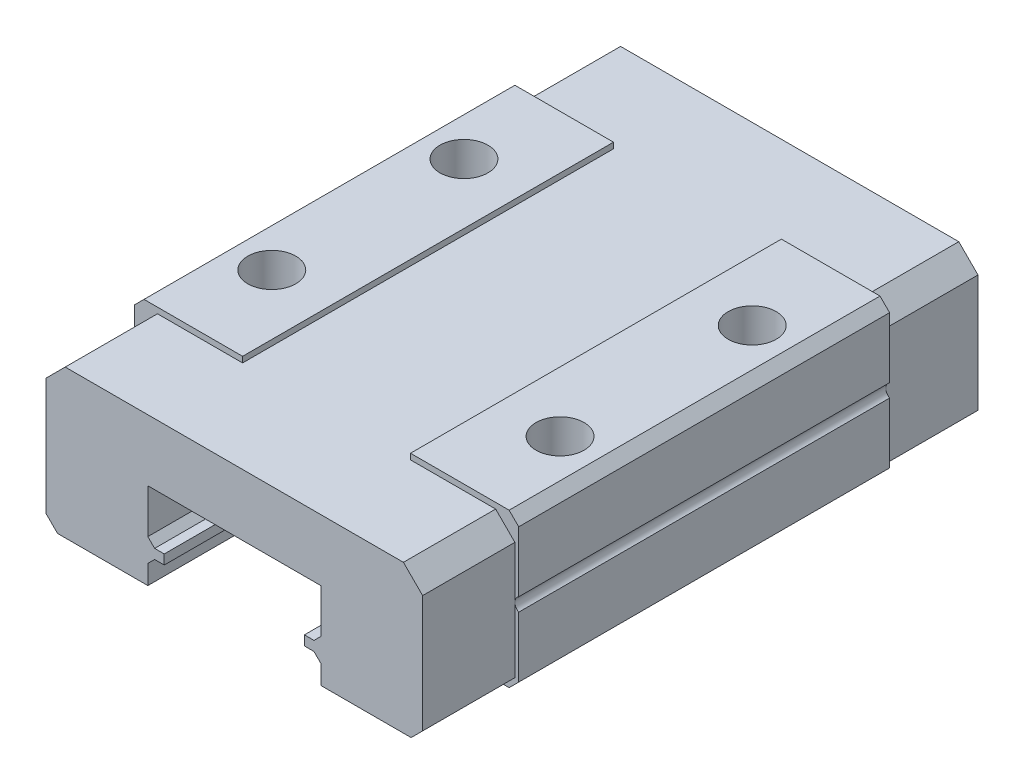
from build123d import *

# Parameters (mm, degrees)
EXTRUDE_1_DEPTH     = 28.9
CHAMFER_1_SIZE      = 0.5
CUT_EXTRUDE_1_DEPTH = 0.3
SKETCH_6_W          = 0.2
SKETCH_6_H          = 4.8
CUT_EXTRUDE_2_DEPTH = 8.3
CHAMFER_2_SIZE      = 1
CHAMFER_3_SIZE      = 0.6
CHAMFER_4_SIZE      = 0.5
SKETCH_7_R          = 0.4
CUT_EXTRUDE_3_DEPTH = 19.3


with BuildPart() as part:
    # 草图1 → 凸台-拉伸1 (new body)
    with BuildSketch(Plane.XY):
        Polygon((-10, 0), (-10, 8), (10, 8), (10, 0), (4.5, 0), (4.5, 1), (4.146446609, 1.353553391), (3.646446609, 1.353553391), (3.646446609, 1.853553391), (4.146446609, 1.853553391), (4.5, 2.207106781), (4.5, 4.5), (-4.5, 4.5), (-4.5, 2.207106781), (-4.146446609, 1.853553391), (-3.646446609, 1.853553391), (-3.646446609, 1.353553391), (-4.146446609, 1.353553391), (-4.5, 1), (-4.5, 0), align=None)
    extrude(amount=-EXTRUDE_1_DEPTH)

    # 草图3 → M3 螺纹孔1 (revolve, cut)
    with BuildSketch(Plane(origin=(7.5, 8, -19.45), x_dir=(0, 0, 1), z_dir=(1, 0, 0))):
        Polygon((0, 0), (0, 3.751075774), (1.25, 3), (1.25, 0), align=None)
    hole_wizard_m3_1 = revolve(axis=Axis((7.5, 14.35, -19.45), (0, -1, 0)), mode=Mode.SUBTRACT)

    # 镜向1: M3 螺纹孔1 across plane
    add(hole_wizard_m3_1.mirror(Plane(origin=(0, 0, -14.45), x_dir=(1, 0, 0), z_dir=(0, 0, -1))), mode=Mode.SUBTRACT)

    # 镜向2: M3 螺纹孔1 across plane
    add(hole_wizard_m3_1.mirror(Plane.ZY), mode=Mode.SUBTRACT)

    # 镜向2 copy 1 sketch → 镜向2 copy 1 (revolve, cut)
    with BuildSketch(Plane(origin=(-7.5, 8, -9.45), x_dir=(0, 0, -1), z_dir=(-1, 0, 0))):
        Polygon((0, 0), (0, 3.751075774), (1.25, 3), (1.25, 0), align=None)
    revolve(axis=Axis((-7.5, 14.35, -9.45), (0, -1, 0)), mode=Mode.SUBTRACT)

    # 倒角1
    chamfer_1_edges = [part.edges().sort_by_distance(p)[0] for p in [
        (10, 8, -14.45),
        (-10, 8, -14.45),
    ]]
    chamfer(chamfer_1_edges, length=CHAMFER_1_SIZE)

    # 草图5 → 切除-拉伸1 (cut)
    with BuildSketch(Plane(origin=(0, 8, 0), x_dir=(1, 0, 0), z_dir=(0, 1, 0))):
        Polygon((-9.5, 24.1), (-4.368581018, 24.1), (-4.368581018, 4.8), (-9.5, 4.8), (-10, 4.8), (-10, 0), (10, 0), (10, 4.8), (9.5, 4.8), (4.368581018, 4.8), (4.368581018, 24.1), (9.5, 24.1), (10, 24.1), (10, 28.9), (-10, 28.9), (-10, 24.1), align=None)
    extrude(amount=-CUT_EXTRUDE_1_DEPTH, mode=Mode.SUBTRACT)

    # 草图6 → 切除-拉伸2 (cut)
    with BuildSketch(Plane(origin=(0, 7.7, 0), x_dir=(1, 0, 0), z_dir=(0, 1, 0))):
        with Locations((-9.9, 26.5)):
            Rectangle(SKETCH_6_W, SKETCH_6_H)
        with Locations((9.9, 26.5)):
            Rectangle(SKETCH_6_W, SKETCH_6_H)
        with Locations((9.9, 2.4)):
            Rectangle(SKETCH_6_W, SKETCH_6_H)
        with Locations((-9.9, 2.4)):
            Rectangle(SKETCH_6_W, SKETCH_6_H)
    extrude(amount=-CUT_EXTRUDE_2_DEPTH, mode=Mode.SUBTRACT)

    # 倒角2
    # the kernel refuses this chamfer: 1 mm, written as the material it takes off along each edge
    with BuildSketch(Plane(origin=(-9.8, 7.7, -4.8), x_dir=(-0.027495876610583895, -0.9996219169112968, 0), z_dir=(0, 0, 1)), Plane(origin=(-9.8, 7.7, -31.471682988), x_dir=(-0.027495876610585623, -0.9996219169112968, 0), z_dir=(0, 0, 1))) as chamfer_2_piece_1:
        Polygon((CHAMFER_2_SIZE * 0.999621916911, CHAMFER_2_SIZE * 0.0274958766106), (-CHAMFER_2_SIZE * 0.0274958766106, CHAMFER_2_SIZE * 0.999621916911), (0, 0), align=None)
    extrude(amount=7.371682988, mode=Mode.SUBTRACT)
    with BuildSketch(Plane(origin=(9.8, 7.7, 2.571682988), x_dir=(-0.9996219169112968, 0.02749587661058651, 0), z_dir=(0, 0, -1)), Plane(origin=(9.8, 7.7, -24.1), x_dir=(-0.9996219169112968, 0.02749587661058651, 0), z_dir=(0, 0, -1))) as chamfer_2_piece_2:
        Polygon((CHAMFER_2_SIZE * 0.999621916911, -CHAMFER_2_SIZE * 0.0274958766106), (-CHAMFER_2_SIZE * 0.0274958766106, -CHAMFER_2_SIZE * 0.999621916911), (0, 0), align=None)
    extrude(amount=7.371682988, mode=Mode.SUBTRACT)

    # 倒角3
    chamfer_3_edges = [part.edges().sort_by_distance(p)[0] for p in [
        (-9.8, 0, -26.5),
        (9.8, 0, -26.5),
        (9.8, 0, -2.4),
        (-9.8, 0, -2.4),
    ]]
    chamfer(chamfer_3_edges, length=CHAMFER_3_SIZE)

    # 倒角4
    chamfer_4_edges = [part.edges().sort_by_distance(p)[0] for p in [
        (-10, 0, -14.45),
        (10, 0, -14.45),
    ]]
    chamfer(chamfer_4_edges, length=CHAMFER_4_SIZE)

    # 草图7 → 切除-拉伸3 (cut)
    with BuildSketch(Plane(origin=(0, 0, -24.1), x_dir=(-1, 0, 0), z_dir=(0, 0, -1))):
        with Locations((-10.2, 4)):
            Circle(SKETCH_7_R)
    extrude(amount=-CUT_EXTRUDE_3_DEPTH, mode=Mode.SUBTRACT)


solid = part.part
